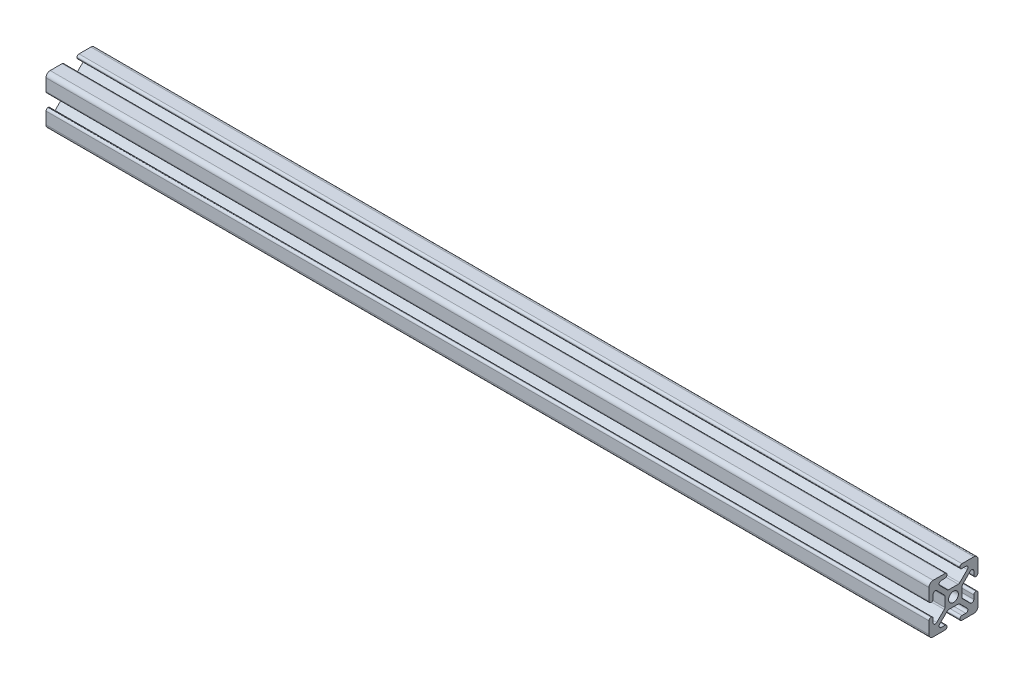
from build123d import *

# Parameters (mm, degrees)
SKETCH1_R           = 2.5
BOSS_EXTRUDE1_DEPTH = 450
FILLET1_R           = 1.065
FILLET2_R           = 2.13


with BuildPart() as part:
    # Sketch1 → Boss-Extrude1 (new body)
    with BuildSketch(Plane.YZ):
        Polygon((-12.5, -3.25), (-12.5, -12.5), (-3.25, -12.5), (-3.25, -10.37), (-8.863862556, -10.37), (-2.873862556, -4.38), (2.873862556, -4.38), (8.863862556, -10.37), (3.25, -10.37), (3.25, -12.5), (12.5, -12.5), (12.5, -3.25), (10.37, -3.25), (10.37, -8.863862556), (4.38, -2.873862556), (4.38, 2.873862556), (10.37, 8.863862556), (10.37, 3.25), (12.5, 3.25), (12.5, 12.5), (3.25, 12.5), (3.25, 10.37), (8.863862556, 10.37), (2.873862556, 4.38), (-2.873862556, 4.38), (-8.863862556, 10.37), (-3.25, 10.37), (-3.25, 12.5), (-12.5, 12.5), (-12.5, 3.25), (-10.37, 3.25), (-10.37, 8.863862556), (-4.38, 2.873862556), (-4.38, -2.873862556), (-10.37, -8.863862556), (-10.37, -3.25), align=None)
        with Locations(Location((0, 0, 0), (0, 0, 270))):
            Circle(SKETCH1_R, mode=Mode.SUBTRACT)
    extrude(amount=BOSS_EXTRUDE1_DEPTH)

    # Fillet1
    fillet1_edges = [part.edges().sort_by_distance(p)[0] for p in [
        (225, -10.37, -8.863862556),
        (225, 2.873862556, -4.38),
        (225, -2.873862556, -4.38),
        (225, -4.38, 2.873862556),
        (225, -4.38, -2.873862556),
        (225, -2.873862556, 4.38),
        (225, 2.873862556, 4.38),
        (225, 4.38, 2.873862556),
        (225, 4.38, -2.873862556),
        (225, -8.863862556, -10.37),
        (225, 8.863862556, -10.37),
        (225, 10.37, -8.863862556),
        (225, -10.37, 8.863862556),
        (225, -8.863862556, 10.37),
        (225, 10.37, 8.863862556),
        (225, 8.863862556, 10.37),
        (225, 12.5, 3.25),
        (225, -3.25, -12.5),
        (225, -10.37, 3.25),
        (225, 10.37, 3.25),
        (225, -10.37, -3.25),
        (225, -12.5, -3.25),
        (225, -12.5, 3.25),
        (225, 3.25, -10.37),
        (225, -3.25, -10.37),
        (225, 3.25, -12.5),
        (225, 10.37, -3.25),
        (225, 12.5, -3.25),
        (225, 3.25, 12.5),
        (225, 3.25, 10.37),
        (225, -3.25, 10.37),
        (225, -3.25, 12.5),
    ]]
    fillet(fillet1_edges, radius=FILLET1_R - 0.0001)  # a hair under: the kernel refuses the full size

    # Fillet2
    fillet2_edges = [part.edges().sort_by_distance(p)[0] for p in [
        (225, -12.5, 12.5),
        (225, 12.5, 12.5),
        (225, 12.5, -12.5),
        (225, -12.5, -12.5),
    ]]
    fillet(fillet2_edges, radius=FILLET2_R)


solid = part.part
